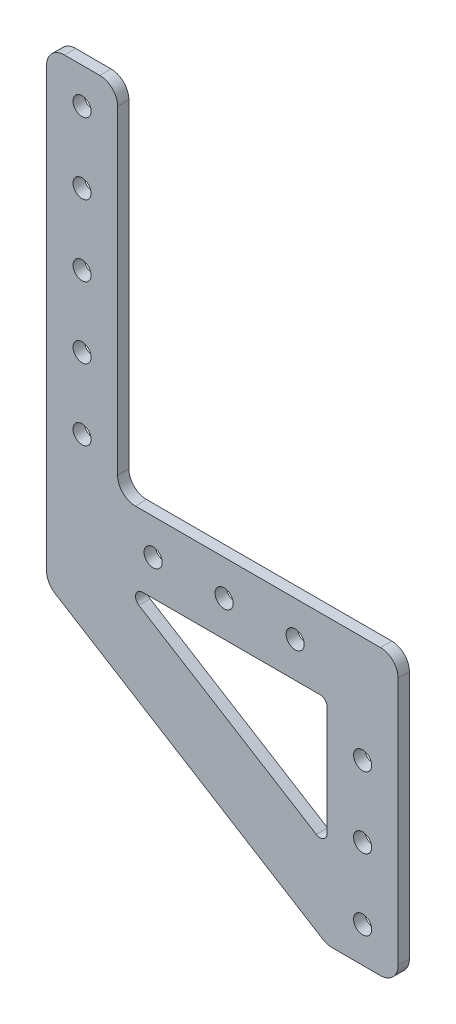
from build123d import *
from OCP.BRepFilletAPI import BRepFilletAPI_MakeFillet

# Parameters (mm, degrees)
SKETCH1_R           = 2.55
BOSS_EXTRUDE1_DEPTH = 1.5875
FILLET1_R1          = 5
FILLET1_R2          = 2


with BuildPart() as part:
    # Sketch1 → Boss-Extrude1 (new, symmetric)
    with BuildSketch(Plane.XY):
        Polygon((-79, 120.002623411), (-59, 120.002623411), (-59, 20), (20, 20), (20, -60), (0, -60), (-79, -11.147376589), align=None)
        with Locations((-69, 110.002623411)):
            Circle(SKETCH1_R, mode=Mode.SUBTRACT)
        with Locations((-69, 90.002623411)):
            Circle(SKETCH1_R, mode=Mode.SUBTRACT)
        with Locations((10, -50)):
            Circle(SKETCH1_R, mode=Mode.SUBTRACT)
        with Locations((10, -30)):
            Circle(SKETCH1_R, mode=Mode.SUBTRACT)
        with Locations((10, -10)):
            Circle(SKETCH1_R, mode=Mode.SUBTRACT)
        with Locations((-49, 10)):
            Circle(SKETCH1_R, mode=Mode.SUBTRACT)
        with Locations((-29, 10)):
            Circle(SKETCH1_R, mode=Mode.SUBTRACT)
        with Locations((-9, 10)):
            Circle(SKETCH1_R, mode=Mode.SUBTRACT)
        with Locations((-69, 70.002623411)):
            Circle(SKETCH1_R, mode=Mode.SUBTRACT)
        with Locations((-69, 50.002623411)):
            Circle(SKETCH1_R, mode=Mode.SUBTRACT)
        with Locations((-69, 30.002623411)):
            Circle(SKETCH1_R, mode=Mode.SUBTRACT)
        Polygon((0, -36.484870649), (0, 0), (-59, 0), align=None, mode=Mode.SUBTRACT)
    extrude(amount=BOSS_EXTRUDE1_DEPTH, both=True)

    # Fillet1: one fillet with a radius per group of edges: ONE call of the kernel's fillet builder (fillet() takes one radius for all edges)
    fillet1_edges_1 = [part.edges().sort_by_distance(p)[0] for p in [
        (-59, 120.002623411, 0),
        (-79, 120.002623411, 0),
        (-59, 20, 0),
        (20, 20, 0),
        (20, -60, 0),
        (0, -60, 0),
        (-79, -11.147376589, 0),
    ]]
    fillet1_edges_2 = [part.edges().sort_by_distance(p)[0] for p in [
        (0, 0, 0),
        (-59, 0, 0),
        (0, -36.484870649, 0),
    ]]
    fillet1 = BRepFilletAPI_MakeFillet(part.part.solid().wrapped)
    for e in fillet1_edges_1:
        fillet1.Add(FILLET1_R1, e.wrapped)
    for e in fillet1_edges_2:
        fillet1.Add(FILLET1_R2, e.wrapped)
    add(Compound.cast(fillet1.Shape()), mode=Mode.REPLACE)


solid = part.part
